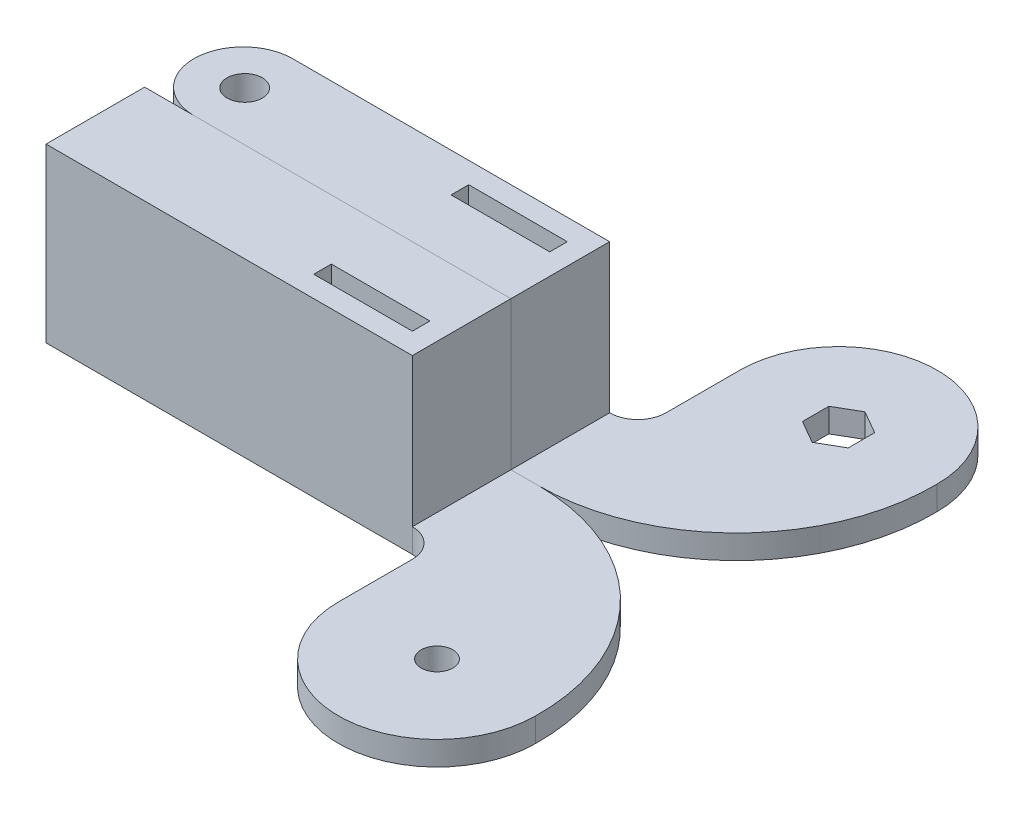
from build123d import *

# Parameters (mm, degrees)
EXTRUDE_1_DEPTH     = 6.8
SKETCH_3_R          = 4.5
CUT_EXTRUDE_1_DEPTH = 152.311731204
SKETCH_5_W          = 104
SKETCH_5_H          = 28
EXTRUDE_3_DEPTH     = 42.08
SKETCH_6_W          = 28
SKETCH_6_H          = 5
CUT_EXTRUDE_3_DEPTH = 6
CUT_EXTRUDE_4_DEPTH = 204.800702648
SKETCH_8_W          = 14.4
SKETCH_8_H          = 14.4
CUT_EXTRUDE_5_DEPTH = 14
SKETCH_9_R          = 5
CUT_EXTRUDE_6_DEPTH = 203.436692326
FILLET_1_R          = 14


with BuildPart() as part:
    # Эскиз1 → Бобышка-Вытянуть1 (new body)
    with BuildSketch(Plane(origin=(0, 0, 0), x_dir=(1, 0, 0), z_dir=(0, 1, 0))):
        with BuildLine():
            ThreePointArc((-28, 0), (0, -28), (28, 0))
            ThreePointArc((28, 0), (11.895099372, 40.186413418), (-28, 57))
            Line((-28, 57), (-140, 57))
            Line((-140, 57), (-140, 29))
            Line((-140, 29), (-36, 29))
            ThreePointArc((-36, 29), (-30.343145751, 26.656854249), (-28, 21))
            Line((-28, 21), (-28, 0))
        make_face()
    extrude(amount=EXTRUDE_1_DEPTH)

    # Эскиз3 → Вырез-Вытянуть1 (cut, through all)
    with BuildSketch(Plane(origin=(0, 0, 0), x_dir=(-1, 0, 0), z_dir=(0, -1, 0))):
        with Locations(Location((0, 0, 0), (0, 0, 90))):
            Circle(SKETCH_3_R)
    extrude(amount=-CUT_EXTRUDE_1_DEPTH, mode=Mode.SUBTRACT)

    # Эскиз5 → Бобышка-Вытянуть3 (add)
    with BuildSketch(Plane(origin=(0, 6.8, 0), x_dir=(1, 0, 0), z_dir=(0, 1, 0))):
        with Locations((-88, 43)):
            Rectangle(SKETCH_5_W, SKETCH_5_H)
    extrude(amount=EXTRUDE_3_DEPTH)

    # Эскиз6 → Вырез-Вытянуть3 (cut)
    with BuildSketch(Plane(origin=(0, 48.88, 0), x_dir=(1, 0, 0), z_dir=(0, 1, 0))):
        with Locations((-56, 37.5)):
            Rectangle(SKETCH_6_W, SKETCH_6_H)
    extrude(amount=-CUT_EXTRUDE_3_DEPTH, mode=Mode.SUBTRACT)


with BuildPart() as body_2:
    # Зеркальное отражение1: mirrored copy
    add(part.part.mirror(Plane(origin=(0, 6.8, -57), x_dir=(1, 0, 0), z_dir=(0, 0, 1))))

    # Эскиз7 → Вырез-Вытянуть4 (cut, through all)
    with BuildSketch(Plane(origin=(0, 6.8, 0), x_dir=(1, 0, 0), z_dir=(0, 1, 0))):
        Polygon((0, 121.5), (-6.495190528, 117.75), (-6.495190528, 110.25), (0, 106.5), (6.495190528, 110.25), (6.495190528, 117.75), align=None)
    extrude(amount=-CUT_EXTRUDE_4_DEPTH, mode=Mode.SUBTRACT)

    # Эскиз8 → Вырез-Вытянуть5 (cut)
    with BuildSketch(Plane.XZ):
        with Locations((-125.6, -71)):
            Rectangle(SKETCH_8_W, SKETCH_8_H)
    extrude(amount=-CUT_EXTRUDE_5_DEPTH, mode=Mode.SUBTRACT)

    # Эскиз9 → Вырез-Вытянуть6 (cut, through all)
    with BuildSketch(Plane.XZ.offset(-14)):
        with Locations(Location((-125.6, -71, 0), (0, 0, 270))):
            Circle(SKETCH_9_R)
    extrude(amount=-CUT_EXTRUDE_6_DEPTH, mode=Mode.SUBTRACT)

    # Скругление1
    fillet_1_edges = [body_2.edges().sort_by_distance(p)[0] for p in [
        (-140, 24.44, -85),
        (-140, 24.44, -57),
    ]]
    fillet(fillet_1_edges, radius=FILLET_1_R - 0.0001)  # a hair under: the kernel refuses the full size


solid = Compound([part.part, body_2.part])
